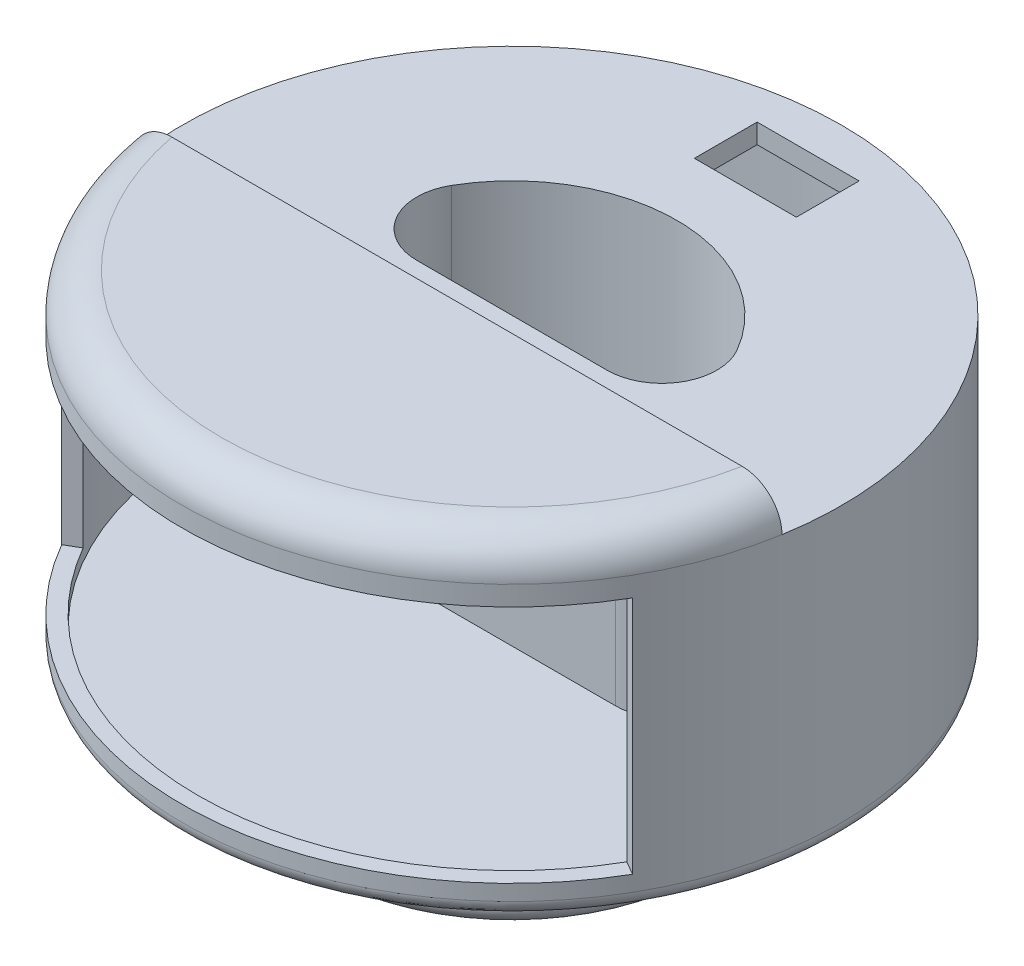
from build123d import *

# Parameters (mm, degrees)
CUT_EXTRUDE1_DEPTH  = 5
CUT_EXTRUDE3_DEPTH  = 45
SKETCH8_R           = 40
CUT_EXTRUDE4_DEPTH  = 32
FILLET1_R           = 7
FILLET2_R           = 7
CUT_REVOLVE1_START  = 17
CUT_REVOLVE1_DEPTH  = 30.5
CUT_EXTRUDE12_DEPTH = 5
SKETCH18_W          = 13
SKETCH18_H          = 8
CUT_EXTRUDE13_DEPTH = 5
SKETCH20_W          = 84
SKETCH20_H          = 7
CUT_EXTRUDE15_DEPTH = 5
SKETCH19_R          = 1.35
CUT_EXTRUDE14_DEPTH = 8


# Read off the part's stored shape, not the designer's step: Cut-Revolve1
with BuildPart() as part:
    # Sketch1 → Revolve1 (revolve)
    with BuildSketch(Plane.XY, mode=Mode.PRIVATE) as revolve1_sk:
        with BuildLine():
            Line((22.5, 0), (23, 0))
            ThreePointArc((23, 0), (24.414213562, 0.585786438), (25, 2))
            Line((25, 2), (25, 13))
            Line((25, 13), (40, 13))
            ThreePointArc((40, 13), (41.414213562, 13.585786438), (42, 15))
            Line((42, 15), (42, 50))
            ThreePointArc((42, 50), (40.535533906, 53.535533906), (37, 55))
            Line((37, 55), (0, 55))
            Line((0, 55), (0, 13))
            Line((0, 13), (22.5, 13))
            Line((22.5, 13), (22.5, 0))
        make_face()
    revolve(revolve1_sk.sketch.rotate(Axis((0, 2, 0), (0, 1, 0)), 90), axis=Axis((0, 2, 0), (0, 1, 0)))

    # Sketch5 → Cut-Extrude1 (cut)
    with BuildSketch(Plane(origin=(0, 55, 0), x_dir=(1, 0, 0), z_dir=(0, 1, 0))):
        with BuildLine():
            Line((-42, 0), (-40, 0))
            Line((-40, 0), (40, 0))
            Line((40, 0), (42, 0))
            ThreePointArc((42, 0), (0, 42), (-42, 0))
        make_face()
    extrude(amount=-CUT_EXTRUDE1_DEPTH, mode=Mode.SUBTRACT)

    # Sketch7 → Cut-Extrude3 (cut)
    with BuildSketch(Plane.XZ.offset(-13)):
        with BuildLine():
            Line((-21, 0), (21, 0))
            ThreePointArc((21, 0), (0, -21), (-21, 0))
        make_face()
    extrude(amount=-CUT_EXTRUDE3_DEPTH, mode=Mode.SUBTRACT)

    # Sketch8 → Cut-Extrude4 (cut)
    with BuildSketch(Plane(origin=(0, 47.5, 0), x_dir=(1, 0, 0), z_dir=(0, 1, 0))):
        with Locations(Location((0, 0, 0), (0, 0, 270))):
            Circle(SKETCH8_R)
        with BuildLine():
            Line((22.912878475, -2), (-22.912878475, -2))
            ThreePointArc((-22.912878475, -2), (0, 23), (22.912878475, -2))
        make_face(mode=Mode.SUBTRACT)
    extrude(amount=-CUT_EXTRUDE4_DEPTH, mode=Mode.SUBTRACT)

    # Fillet1
    fillet1_edges = [part.edges().sort_by_distance(p)[0] for p in [
        (21, 31.5, 0),
        (-21, 31.5, 0),
    ]]
    fillet(fillet1_edges, radius=FILLET1_R)

    # Fillet2
    fillet2_edges = [part.edges().sort_by_distance(p)[0] for p in [
        (-22.912878475, 31.5, 2),
        (22.912878475, 31.5, 2),
    ]]
    fillet(fillet2_edges, radius=FILLET2_R)

    # Cut-Revolve1 outline → Cut-Revolve1 (cut)
    with BuildSketch(Plane(origin=(0, 0, 0), x_dir=(1, 0, 0), z_dir=(0, 1, 0)).offset(CUT_REVOLVE1_START)):
        with BuildLine():
            Line((-34.641016151, -20), (-36.373066959, -21))
            ThreePointArc((-36.373066959, -21), (0, -42), (36.373066959, -21))
            Line((36.373066959, -21), (34.641016151, -20))
            ThreePointArc((34.641016151, -20), (0, -40), (-34.641016151, -20))
        make_face()
    extrude(amount=CUT_REVOLVE1_DEPTH, mode=Mode.SUBTRACT)

    # Sketch15 → Cut-Extrude12 (cut)
    with BuildSketch(Plane(origin=(0, 15.5, 0), x_dir=(1, 0, 0), z_dir=(0, 1, 0))):
        with BuildLine():
            Line((-28.124355653, -3.514579578), (-26.124355653, -3.514579578))
            ThreePointArc((-26.124355653, -3.514579578), (-24.710142091, -2.928793141), (-24.124355653, -1.514579578))
            Line((-24.124355653, -1.514579578), (-24.124355653, 8.485420422))
            ThreePointArc((-24.124355653, 8.485420422), (-24.710142091, 9.899633984), (-26.124355653, 10.485420422))
            Line((-26.124355653, 10.485420422), (-28.124355653, 10.485420422))
            ThreePointArc((-28.124355653, 10.485420422), (-29.538569215, 9.899633984), (-30.124355653, 8.485420422))
            Line((-30.124355653, 8.485420422), (-30.124355653, -1.514579578))
            ThreePointArc((-30.124355653, -1.514579578), (-29.538569215, -2.928793141), (-28.124355653, -3.514579578))
        make_face()
    extrude(amount=-CUT_EXTRUDE12_DEPTH, mode=Mode.SUBTRACT)

    # Sketch18 → Cut-Extrude13 (cut)
    with BuildSketch(Plane(origin=(0, 50, 0), x_dir=(1, 0, 0), z_dir=(0, 1, 0))):
        with Locations((0.796512215, 32.951769165)):
            Rectangle(SKETCH18_W, SKETCH18_H)
    extrude(amount=-CUT_EXTRUDE13_DEPTH, mode=Mode.SUBTRACT)

    # Sketch20 → Cut-Extrude15 (cut)
    with BuildSketch(Plane(origin=(0, 55, 0), x_dir=(1, 0, 0), z_dir=(0, 1, 0))):
        with Locations((0, -3.5)):
            Rectangle(SKETCH20_W, SKETCH20_H)
    extrude(amount=-CUT_EXTRUDE15_DEPTH, mode=Mode.SUBTRACT)

    # Sketch19 → Cut-Extrude14 (cut)
    with BuildSketch(Plane(origin=(0, 0, 7), x_dir=(-1, 0, 0), z_dir=(0, 0, -1))):
        with Locations((0, 52.5)):
            Circle(SKETCH19_R)
        with Locations((-29.412558482, 52.5)):
            Circle(SKETCH19_R)
        with Locations((29.412558482, 52.5)):
            Circle(SKETCH19_R)
    extrude(amount=-CUT_EXTRUDE14_DEPTH, mode=Mode.SUBTRACT)


solid = part.part
